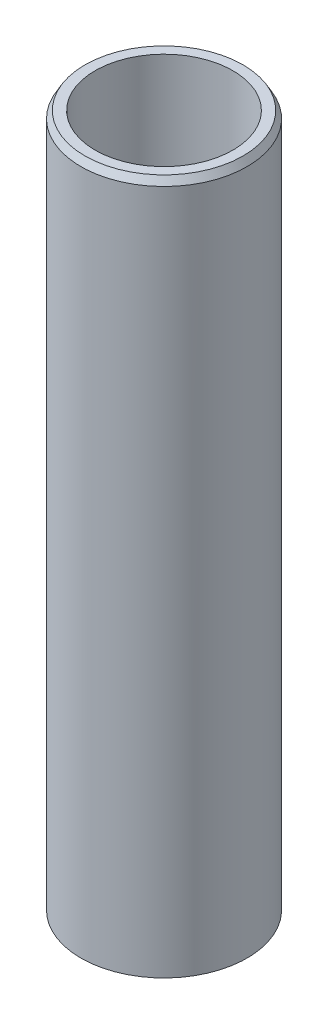
from build123d import *
from OCP.BRepFilletAPI import BRepFilletAPI_MakeChamfer

# Parameters (mm, degrees)
SKETCH1_R           = 55
BOSS_EXTRUDE1_DEPTH = 460.940624876
SKETCH2_R           = 45.577350967
CUT_EXTRUDE1_DEPTH  = 468.457227627
CHAMFER1_SIZE       = 4.718825733
CHAMFER1_SIZE2      = 2.724415307


with BuildPart() as part:
    # Sketch1 → Boss-Extrude1 (new body)
    with BuildSketch(Plane(origin=(0, 0, 0), x_dir=(1, 0, 0), z_dir=(0, 1, 0))):
        Circle(SKETCH1_R)
    extrude(amount=BOSS_EXTRUDE1_DEPTH)

    # Sketch2 → Cut-Extrude1 (cut, through all)
    with BuildSketch(Plane(origin=(0, 0, 0), x_dir=(1, 0, 0), z_dir=(0, 1, 0))):
        Circle(SKETCH2_R)
    extrude(amount=CUT_EXTRUDE1_DEPTH, mode=Mode.SUBTRACT)

    # Chamfer1: one chamfer whose edges measure the first distance from different faces: ONE call of the kernel's chamfer builder (chamfer() names one face for all edges)
    chamfer1_edges_1 = [part.edges().sort_by_distance(p)[0] for p in [
        (-55, 460.940624876, 0),
    ]]
    chamfer1_side_1 = [part.faces().sort_by_distance(p)[0] for p in [
        (-55, 230.470312438, 0),
    ]]
    chamfer1_edges_2 = [part.edges().sort_by_distance(p)[0] for p in [
        (-55, 0, 0),
    ]]
    chamfer1_side_2 = [part.faces().sort_by_distance(p)[0] for p in [
        (-53.444365081, 0, 0),
    ]]
    chamfer1 = BRepFilletAPI_MakeChamfer(part.part.solid().wrapped)
    for e in chamfer1_edges_1:
        chamfer1.Add(CHAMFER1_SIZE, CHAMFER1_SIZE2, e.wrapped, chamfer1_side_1[0].wrapped)  # the first distance lies on this face
    for e in chamfer1_edges_2:
        chamfer1.Add(CHAMFER1_SIZE, CHAMFER1_SIZE2, e.wrapped, chamfer1_side_2[0].wrapped)  # the first distance lies on this face
    add(Compound.cast(chamfer1.Shape()), mode=Mode.REPLACE)


solid = part.part
